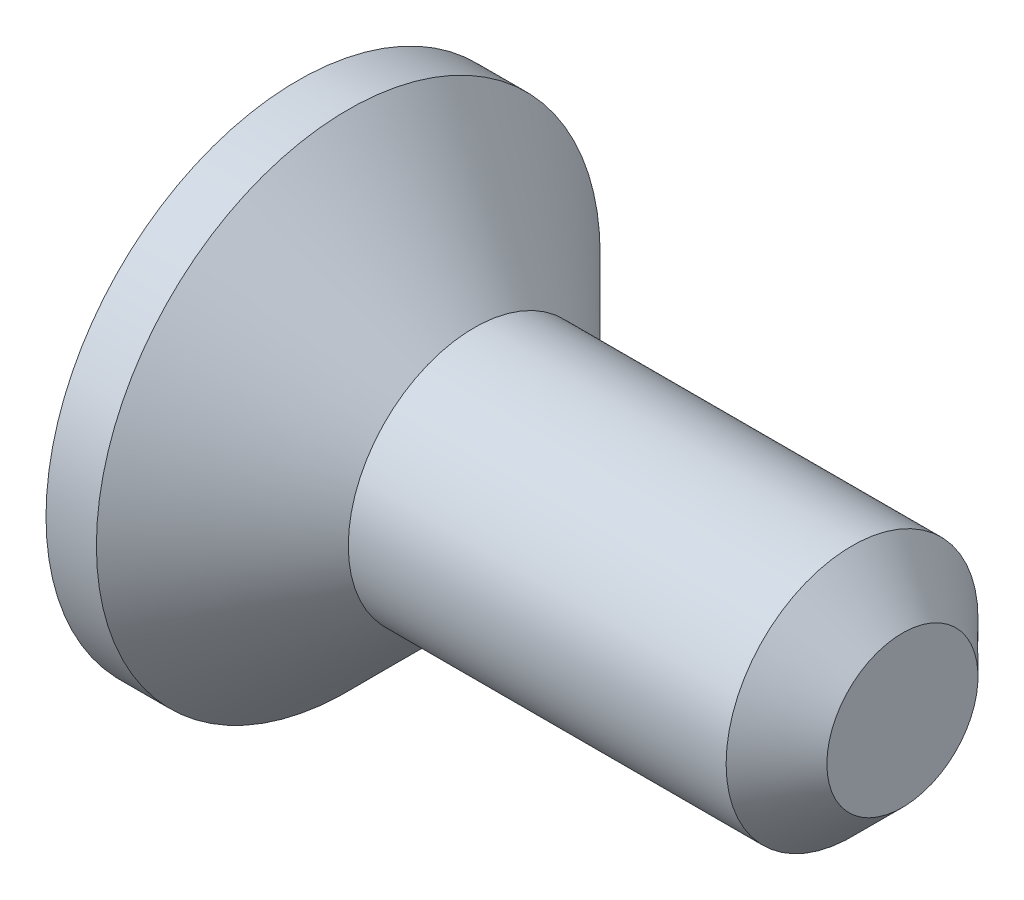
from build123d import *

# Parameters (mm, degrees)
CUT_EXTRUDE1_DEPTH = 0.8


with BuildPart() as part:
    # Sketch2 → Revolve1 (revolve)
    with BuildSketch(Plane.XY):
        Polygon((0, 0), (0, 2.5), (0.5, 2.5), (1.75, 1.25), (5.5, 1.25), (6, 0.75), (6, 0), align=None)
    revolve(axis=Axis((-2.281841559, 0, 0), (1, 0, 0)))

    # Sketch3 → Cut-Extrude1 (cut)
    with BuildSketch(Plane.ZY):
        Polygon((0.433012702, -0.75), (0.866025404, 0), (0.433012702, 0.75), (-0.433012702, 0.75), (-0.866025404, 0), (-0.433012702, -0.75), align=None)
    extrude(amount=-CUT_EXTRUDE1_DEPTH, mode=Mode.SUBTRACT)


solid = part.part
